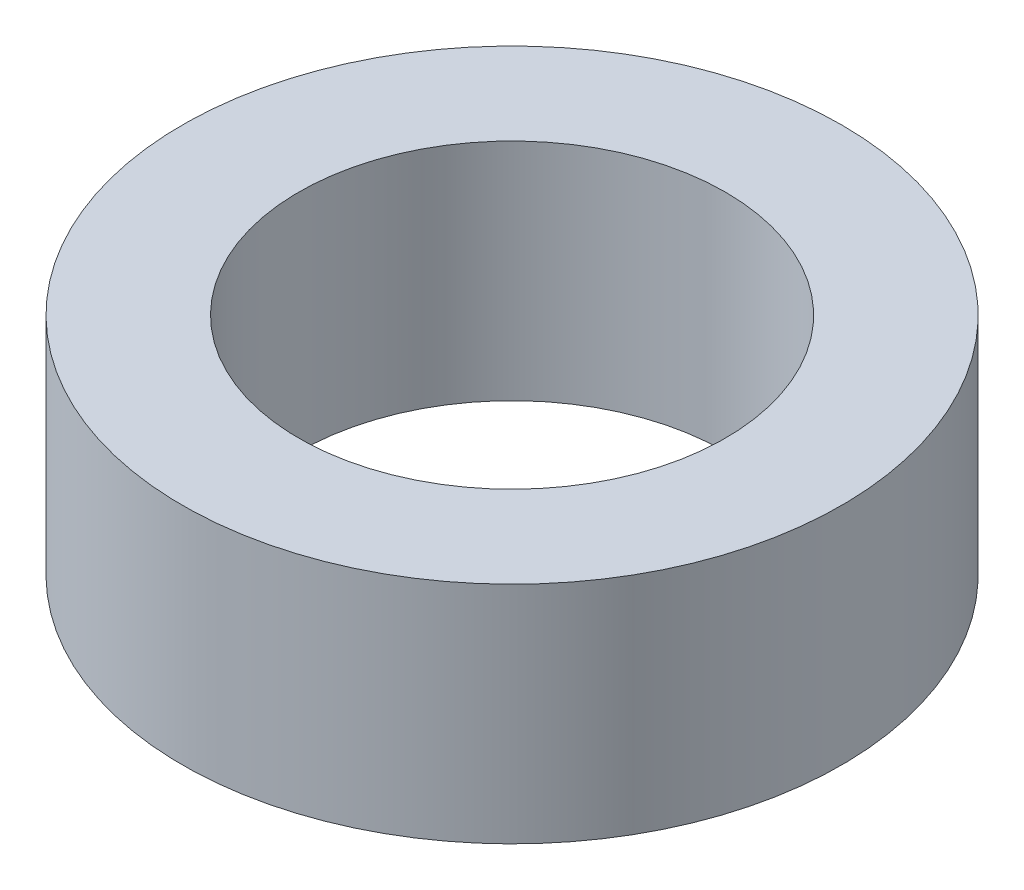
from build123d import *

# Parameters (mm, degrees)
SKETCH1_R           = 42.5
BOSS_EXTRUDE1_DEPTH = 29
SKETCH2_R           = 27.5
CUT_EXTRUDE1_DEPTH  = 67.734548773


with BuildPart() as part:
    # Sketch1 → Boss-Extrude1 (new body)
    with BuildSketch(Plane(origin=(0, 0, 0), x_dir=(1, 0, 0), z_dir=(0, 1, 0))):
        Circle(SKETCH1_R)
    extrude(amount=BOSS_EXTRUDE1_DEPTH)

    # Sketch2 → Cut-Extrude1 (cut, through all)
    with BuildSketch(Plane(origin=(0, 0, 0), x_dir=(1, 0, 0), z_dir=(0, 1, 0))):
        Circle(SKETCH2_R)
    extrude(amount=CUT_EXTRUDE1_DEPTH, mode=Mode.SUBTRACT)


solid = part.part
